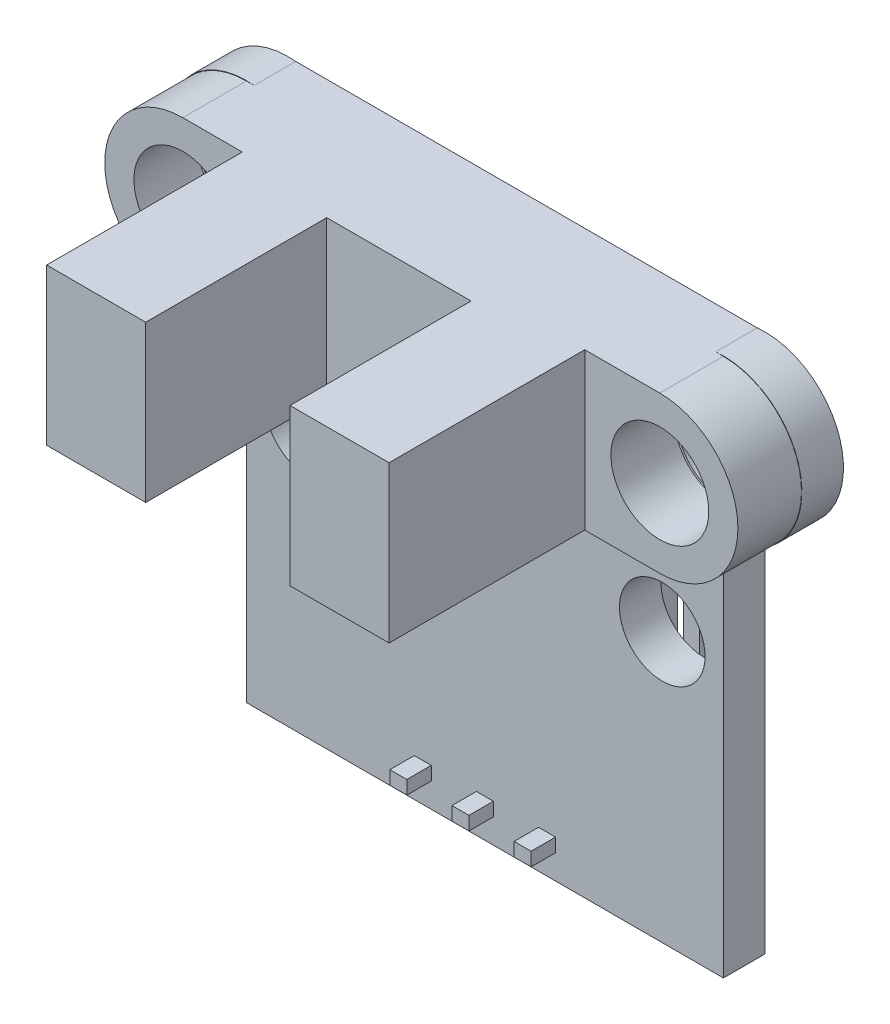
from build123d import *

# Parameters (mm, degrees)
IZIM1_R                     = 1.900647948
IZIM1_R_2                   = 1.75
Y_KSEKLIK_EKSTR_ZYON1_DEPTH = 1.7
IZIM2_R                     = 2
Y_KSEKLIK_EKSTR_ZYON2_DEPTH = 2.6
IZIM3_W                     = 4.050055298
IZIM3_H                     = 6.384195941
Y_KSEKLIK_EKSTR_ZYON3_DEPTH = 8
IZIM4_W                     = 5.9
IZIM4_H                     = 6.384195941
Y_KSEKLIK_EKSTR_ZYON4_DEPTH = 0.6
Y_KSEKLIK_EKSTR_ZYON6_DEPTH = 2.54
IZIM6_W                     = 19.5
IZIM6_H                     = 1.7
Y_KSEKLIK_EKSTR_ZYON7_DEPTH = 0.01
KES_EKSTR_ZYON1_DEPTH       = 5.9
KES_EKSTR_ZYON1_DEPTH_BACK  = 0.1
IZIM7_W                     = 6.75
IZIM7_H                     = 0.75
IZIM8_W                     = 0.664910115
IZIM8_H                     = 0.664910116
IZIM11_W                    = 0.693181836
IZIM11_H                    = 0.554146416
Y_KSEKLIK_EKSTR_ZYON8_DEPTH = 1
Y_KSEKLIK_EKSTR_ZYON9_DEPTH = 1.5


with BuildPart() as part:
    # Çizim1 → Yükseklik-Ekstrüzyon1 (new body)
    with BuildSketch(Plane.XY):
        with BuildLine():
            Line((-9.431965443, -11), (10.068034557, -11))
            Line((10.068034557, -11), (10.068034557, 4.6))
            ThreePointArc((10.068034557, 4.6), (13.271983136, 7.967115525), (9.75, 11))
            Line((9.75, 11), (-9.113930886, 11))
            ThreePointArc((-9.113930886, 11), (-12.635914021, 7.967115525), (-9.431965443, 4.6))
            Line((-9.431965443, 4.6), (-9.431965443, -11))
        make_face()
        with Locations((10.068034557, 7.80790203)):
            Circle(IZIM1_R, mode=Mode.SUBTRACT)
        with Locations((-9.431965443, 7.80790203)):
            Circle(IZIM1_R, mode=Mode.SUBTRACT)
        with Locations((7.568034557, 0)):
            Circle(IZIM1_R_2, mode=Mode.SUBTRACT)
        with Locations((-6.931965443, 0)):
            Circle(IZIM1_R_2, mode=Mode.SUBTRACT)
    extrude(amount=Y_KSEKLIK_EKSTR_ZYON1_DEPTH)

    # Çizim2 → Yükseklik-Ekstrüzyon2 (add)
    with BuildSketch(Plane.XY.offset(1.7)):
        with BuildLine():
            Line((-9.431965443, 11), (10.068034557, 11))
            ThreePointArc((10.068034557, 11), (13.260132528, 7.80790203), (10.068034557, 4.615804059))
            Line((10.068034557, 4.615804059), (-9.431965443, 4.615804059))
            ThreePointArc((-9.431965443, 4.615804059), (-12.624063413, 7.80790203), (-9.431965443, 11))
        make_face()
        with Locations((-9.431965443, 7.80790203)):
            Circle(IZIM2_R, mode=Mode.SUBTRACT)
        with Locations((10.068034557, 7.80790203)):
            Circle(IZIM2_R, mode=Mode.SUBTRACT)
    extrude(amount=Y_KSEKLIK_EKSTR_ZYON2_DEPTH)

    # Çizim3 → Yükseklik-Ekstrüzyon3 (add)
    with BuildSketch(Plane.XY.offset(4.3)):
        with Locations((4.975027649, 7.80790203)):
            Rectangle(IZIM3_W, IZIM3_H)
        with Locations((-4.975027649, 7.80790203)):
            Rectangle(IZIM3_W, IZIM3_H)
    extrude(amount=Y_KSEKLIK_EKSTR_ZYON3_DEPTH)

    # Çizim4 → Yükseklik-Ekstrüzyon4 (add)
    with BuildSketch(Plane.XY.offset(4.3)):
        with Locations((0, 7.80790203)):
            Rectangle(IZIM4_W, IZIM4_H)
    extrude(amount=Y_KSEKLIK_EKSTR_ZYON4_DEPTH)

    # Çizim5 → Yükseklik-Ekstrüzyon6 (add)
    with BuildSketch(Plane(origin=(0, 0, 0), x_dir=(-1, 0, 0), z_dir=(0, 0, -1))):
        Polygon((0.951965443, -8.71), (0.701965443, -8.46), (-1.338034557, -8.46), (-1.588034557, -8.71), (-1.838034557, -8.46), (-3.878034557, -8.46), (-4.128034557, -8.71), (-4.128034557, -10.75), (-3.878034557, -11), (-1.838034557, -11), (-1.588034557, -10.75), (-1.338034557, -11), (0.701965443, -11), (0.951965443, -10.75), (1.201965443, -11), (3.241965443, -11), (3.491965443, -10.75), (3.491965443, -8.71), (3.241965443, -8.46), (1.201965443, -8.46), align=None)
    extrude(amount=Y_KSEKLIK_EKSTR_ZYON6_DEPTH)

    # Çizim6 → Yükseklik-Ekstrüzyon7 (add)
    with BuildSketch(Plane.XZ.offset(11)):
        with Locations((0.318034557, 0.85)):
            Rectangle(IZIM6_W, IZIM6_H)
    extrude(amount=Y_KSEKLIK_EKSTR_ZYON7_DEPTH)

    # Çizim7 → Kes-Ekstrüzyon1 (cut, two sides: drawn at the far end of the back side and taken through both)
    with BuildSketch(Plane.ZY.offset(-2.95).offset(-KES_EKSTR_ZYON1_DEPTH_BACK)):
        with Locations((8.275, 7.80790203)):
            Rectangle(IZIM7_W, IZIM7_H)
    extrude(amount=KES_EKSTR_ZYON1_DEPTH + KES_EKSTR_ZYON1_DEPTH_BACK, mode=Mode.SUBTRACT)

    # Süpür1: sweep along a path in Çizim9
    with BuildLine(Plane(origin=(0, 0, 0), x_dir=(0, 0, -1), z_dir=(1, 0, 0))) as s_p_r1_path:
        Line((2.54, -9.73), (4.04, -9.73))
        ThreePointArc((4.04, -9.73), (4.393553391, -9.583553391), (4.54, -9.23))
        Line((4.54, -9.23), (4.54, -3.305))
    # Çizim8 → Süpür1 (sweep)
    with BuildSketch(Plane(origin=(0, 0, -2.54), x_dir=(-1, 0, 0), z_dir=(0, 0, -1))):
        with Locations((2.221965443, -9.73)):
            Rectangle(IZIM8_W, IZIM8_H)
        with Locations((-0.318034558, -9.73)):
            Rectangle(IZIM8_W, IZIM8_H)
        with Locations((-2.858034557, -9.73)):
            Rectangle(IZIM8_W, IZIM8_H)
    sweep(path=s_p_r1_path.line)

    # Çizim11 → Yükseklik-Ekstrüzyon8 (add)
    with BuildSketch(Plane.XY.offset(1.7)):
        with Locations((-2.221965443, -9.73)):
            Rectangle(IZIM11_W, IZIM11_H)
        with Locations((0.318034557, -9.73)):
            Rectangle(IZIM11_W, IZIM11_H)
        with Locations((2.858034557, -9.73)):
            Rectangle(IZIM11_W, IZIM11_H)
    extrude(amount=Y_KSEKLIK_EKSTR_ZYON8_DEPTH)

    # Çizim12 → Yükseklik-Ekstrüzyon9 (add)
    with BuildSketch(Plane(origin=(0, 0, 0), x_dir=(-1, 0, 0), z_dir=(0, 0, -1))):
        Polygon((-4.998159683, 0), (-4.998159683, 2.331223734), (-1.20341454, 2.331223734), (-1.20341454, -3.045965908), (-4.998159683, -3.045965908), align=None)
    extrude(amount=Y_KSEKLIK_EKSTR_ZYON9_DEPTH)


solid = part.part
